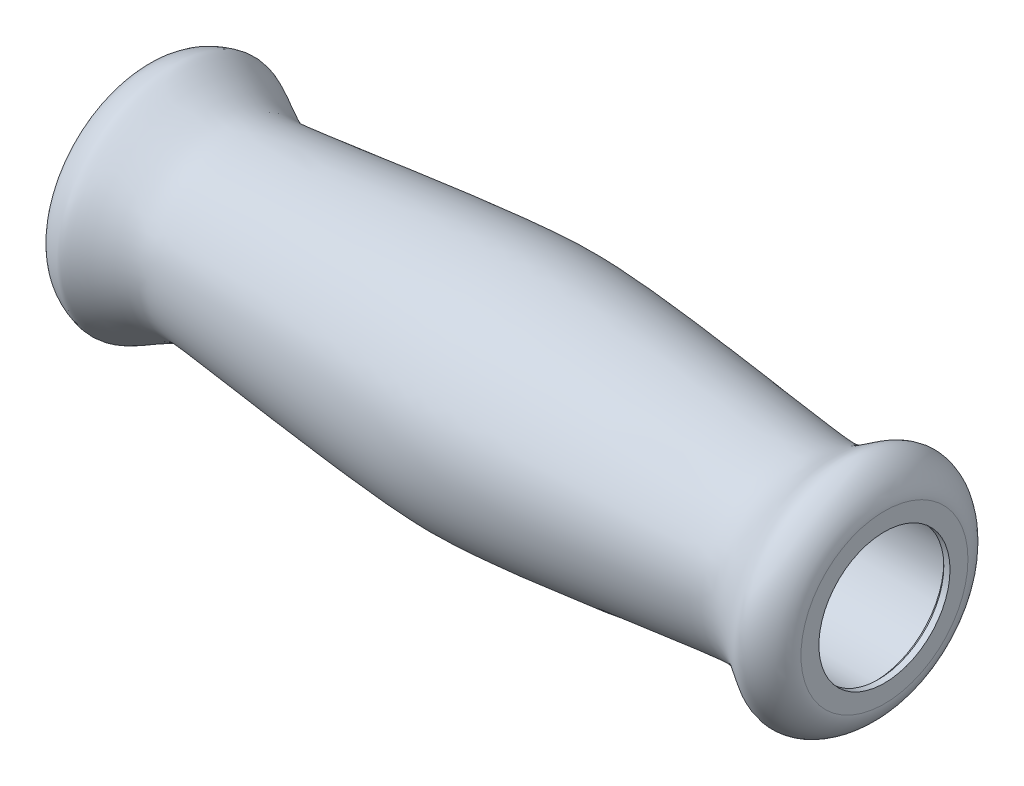
from build123d import *

# Parameters (mm, degrees)
SKETCH1_R           = 13.5
SKETCH1_R_2         = 11.2
BOSS_EXTRUDE1_DEPTH = 60
CIRPATTERN1_COUNT   = 8
LPATTERN1_COUNT     = 3
LPATTERN1_PITCH     = 20
FILLET1_R           = 3
SKETCH4_R           = 13.5
SKETCH4_R_2         = 11.2
BOSS_EXTRUDE2_DEPTH = 60
BOSS_EXTRUDE3_START = -1
SKETCH5_R           = 11.2
SKETCH5_R_2         = 10.6
BOSS_EXTRUDE3_DEPTH = 1
CHAMFER1_SIZE       = 0.6


# Some blends are built 0.0001 mm under size
with BuildPart() as part:
    # Sketch1 → Boss-Extrude1 (new body)
    with BuildSketch(Plane(origin=(0, 0, 0), x_dir=(0, 0, -1), z_dir=(1, 0, 0))):
        Circle(SKETCH1_R)
        Circle(SKETCH1_R_2, mode=Mode.SUBTRACT)
    extrude(amount=BOSS_EXTRUDE1_DEPTH)

    # Sketch2 → Cut-Revolve1 (revolve, cut)
    with BuildSketch(Plane.XY):
        with BuildLine():
            Line((8, 12.6), (8, 9.6))
            Line((8, 9.6), (11, 9.6))
            ThreePointArc((11, 9.6), (10.121320344, 11.721320344), (8, 12.6))
        make_face()
    cut_revolve1 = revolve(axis=Axis((8, 12.6, 0), (0, -1, 0)), mode=Mode.SUBTRACT)

    # CirPattern1: Cut-Revolve1 ×8 about axis
    cirpattern1_axis = Axis((0, 0, 0), (1, 0, 0))
    for i in range(1, CIRPATTERN1_COUNT):
        add(cut_revolve1.rotate(cirpattern1_axis, i * 360 / CIRPATTERN1_COUNT), mode=Mode.SUBTRACT)

    # LPattern1: Cut-Revolve1 ×3
    with Locations(*[(i * LPATTERN1_PITCH, 0, 0) for i in range(1, LPATTERN1_COUNT)]):
        add(cut_revolve1, mode=Mode.SUBTRACT)

    # LPattern1 copy 1 sketch → LPattern1 copy 1 (revolve, cut)
    with BuildSketch(Plane(origin=(20, 0, 0), x_dir=(1, 0, 0), z_dir=(0, -0.7071067811865475, 0.7071067811865476))):
        with BuildLine():
            Line((8, 12.6), (8, 9.6))
            Line((8, 9.6), (11, 9.6))
            ThreePointArc((11, 9.6), (10.121320344, 11.721320344), (8, 12.6))
        make_face()
    revolve(axis=Axis((28, 8.909545443, 8.909545443), (0, -0.7071067811865476, -0.7071067811865475)), mode=Mode.SUBTRACT)

    # LPattern1 copy 2 sketch → LPattern1 copy 2 (revolve, cut)
    with BuildSketch(Plane(origin=(40, 0, 0), x_dir=(1, 0, 0), z_dir=(0, -0.7071067811865475, 0.7071067811865476))):
        with BuildLine():
            Line((8, 12.6), (8, 9.6))
            Line((8, 9.6), (11, 9.6))
            ThreePointArc((11, 9.6), (10.121320344, 11.721320344), (8, 12.6))
        make_face()
    revolve(axis=Axis((48, 8.909545443, 8.909545443), (0, -0.7071067811865476, -0.7071067811865475)), mode=Mode.SUBTRACT)

    # LPattern1 copy 3 sketch → LPattern1 copy 3 (revolve, cut)
    with BuildSketch(Plane(origin=(20, 0, 0), x_dir=(1, 0, 0), z_dir=(0, -1, 0))):
        with BuildLine():
            Line((8, 12.6), (8, 9.6))
            Line((8, 9.6), (11, 9.6))
            ThreePointArc((11, 9.6), (10.121320344, 11.721320344), (8, 12.6))
        make_face()
    revolve(axis=Axis((28, 0, 12.6), (0, 0, -1)), mode=Mode.SUBTRACT)

    # LPattern1 copy 4 sketch → LPattern1 copy 4 (revolve, cut)
    with BuildSketch(Plane(origin=(40, 0, 0), x_dir=(1, 0, 0), z_dir=(0, -1, 0))):
        with BuildLine():
            Line((8, 12.6), (8, 9.6))
            Line((8, 9.6), (11, 9.6))
            ThreePointArc((11, 9.6), (10.121320344, 11.721320344), (8, 12.6))
        make_face()
    revolve(axis=Axis((48, 0, 12.6), (0, 0, -1)), mode=Mode.SUBTRACT)

    # LPattern1 copy 5 sketch → LPattern1 copy 5 (revolve, cut)
    with BuildSketch(Plane(origin=(20, 0, 0), x_dir=(1, 0, 0), z_dir=(0, -0.7071067811865476, -0.7071067811865475))):
        with BuildLine():
            Line((8, 12.6), (8, 9.6))
            Line((8, 9.6), (11, 9.6))
            ThreePointArc((11, 9.6), (10.121320344, 11.721320344), (8, 12.6))
        make_face()
    revolve(axis=Axis((28, -8.909545443, 8.909545443), (0, 0.7071067811865475, -0.7071067811865476)), mode=Mode.SUBTRACT)

    # LPattern1 copy 6 sketch → LPattern1 copy 6 (revolve, cut)
    with BuildSketch(Plane(origin=(40, 0, 0), x_dir=(1, 0, 0), z_dir=(0, -0.7071067811865476, -0.7071067811865475))):
        with BuildLine():
            Line((8, 12.6), (8, 9.6))
            Line((8, 9.6), (11, 9.6))
            ThreePointArc((11, 9.6), (10.121320344, 11.721320344), (8, 12.6))
        make_face()
    revolve(axis=Axis((48, -8.909545443, 8.909545443), (0, 0.7071067811865475, -0.7071067811865476)), mode=Mode.SUBTRACT)

    # LPattern1 copy 7 sketch → LPattern1 copy 7 (revolve, cut)
    with BuildSketch(Plane(origin=(20, 0, 0), x_dir=(1, 0, 0), z_dir=(0, 0, -1))):
        with BuildLine():
            Line((8, 12.6), (8, 9.6))
            Line((8, 9.6), (11, 9.6))
            ThreePointArc((11, 9.6), (10.121320344, 11.721320344), (8, 12.6))
        make_face()
    revolve(axis=Axis((28, -12.6, 0), (0, 1, 0)), mode=Mode.SUBTRACT)

    # LPattern1 copy 8 sketch → LPattern1 copy 8 (revolve, cut)
    with BuildSketch(Plane(origin=(40, 0, 0), x_dir=(1, 0, 0), z_dir=(0, 0, -1))):
        with BuildLine():
            Line((8, 12.6), (8, 9.6))
            Line((8, 9.6), (11, 9.6))
            ThreePointArc((11, 9.6), (10.121320344, 11.721320344), (8, 12.6))
        make_face()
    revolve(axis=Axis((48, -12.6, 0), (0, 1, 0)), mode=Mode.SUBTRACT)

    # LPattern1 copy 9 sketch → LPattern1 copy 9 (revolve, cut)
    with BuildSketch(Plane(origin=(20, 0, 0), x_dir=(1, 0, 0), z_dir=(0, 0.7071067811865475, -0.7071067811865477))):
        with BuildLine():
            Line((8, 12.6), (8, 9.6))
            Line((8, 9.6), (11, 9.6))
            ThreePointArc((11, 9.6), (10.121320344, 11.721320344), (8, 12.6))
        make_face()
    revolve(axis=Axis((28, -8.909545443, -8.909545443), (0, 0.7071067811865477, 0.7071067811865475)), mode=Mode.SUBTRACT)

    # LPattern1 copy 10 sketch → LPattern1 copy 10 (revolve, cut)
    with BuildSketch(Plane(origin=(40, 0, 0), x_dir=(1, 0, 0), z_dir=(0, 0.7071067811865475, -0.7071067811865477))):
        with BuildLine():
            Line((8, 12.6), (8, 9.6))
            Line((8, 9.6), (11, 9.6))
            ThreePointArc((11, 9.6), (10.121320344, 11.721320344), (8, 12.6))
        make_face()
    revolve(axis=Axis((48, -8.909545443, -8.909545443), (0, 0.7071067811865477, 0.7071067811865475)), mode=Mode.SUBTRACT)

    # LPattern1 copy 11 sketch → LPattern1 copy 11 (revolve, cut)
    with BuildSketch(Plane(origin=(20, 0, 0), x_dir=(1, 0, 0), z_dir=(0, 1, 0))):
        with BuildLine():
            Line((8, 12.6), (8, 9.6))
            Line((8, 9.6), (11, 9.6))
            ThreePointArc((11, 9.6), (10.121320344, 11.721320344), (8, 12.6))
        make_face()
    revolve(axis=Axis((28, 0, -12.6), (0, 0, 1)), mode=Mode.SUBTRACT)

    # LPattern1 copy 12 sketch → LPattern1 copy 12 (revolve, cut)
    with BuildSketch(Plane(origin=(40, 0, 0), x_dir=(1, 0, 0), z_dir=(0, 1, 0))):
        with BuildLine():
            Line((8, 12.6), (8, 9.6))
            Line((8, 9.6), (11, 9.6))
            ThreePointArc((11, 9.6), (10.121320344, 11.721320344), (8, 12.6))
        make_face()
    revolve(axis=Axis((48, 0, -12.6), (0, 0, 1)), mode=Mode.SUBTRACT)

    # LPattern1 copy 13 sketch → LPattern1 copy 13 (revolve, cut)
    with BuildSketch(Plane(origin=(20, 0, 0), x_dir=(1, 0, 0), z_dir=(0, 0.7071067811865477, 0.7071067811865474))):
        with BuildLine():
            Line((8, 12.6), (8, 9.6))
            Line((8, 9.6), (11, 9.6))
            ThreePointArc((11, 9.6), (10.121320344, 11.721320344), (8, 12.6))
        make_face()
    revolve(axis=Axis((28, 8.909545443, -8.909545443), (0, -0.7071067811865474, 0.7071067811865477)), mode=Mode.SUBTRACT)

    # LPattern1 copy 14 sketch → LPattern1 copy 14 (revolve, cut)
    with BuildSketch(Plane(origin=(40, 0, 0), x_dir=(1, 0, 0), z_dir=(0, 0.7071067811865477, 0.7071067811865474))):
        with BuildLine():
            Line((8, 12.6), (8, 9.6))
            Line((8, 9.6), (11, 9.6))
            ThreePointArc((11, 9.6), (10.121320344, 11.721320344), (8, 12.6))
        make_face()
    revolve(axis=Axis((48, 8.909545443, -8.909545443), (0, -0.7071067811865474, 0.7071067811865477)), mode=Mode.SUBTRACT)

    # Fillet1
    # the kernel refuses this fillet: 3 mm, written as the material it takes off along each edge
    with BuildSketch(Plane(origin=(0, 0, 0), x_dir=(0, 0, -1), z_dir=(0, -1, 0))) as fillet1_piece_1:
        with BuildLine():
            CenterArc((14.2, 2.917190429), FILLET1_R, 180, 76.506601178)
            Line((11.2, 2.917190429), (11.14, 2.917190429))
            Line((11.14, 2.917190429), (11.14, 0))
            Line((11.14, 0), (11.2, -0.06))
            ThreePointArc((11.2, -0.06), (12.35, -0.06), (13.486, -0.058343809))
            Line((13.486, -0.058343809), (13.5, 0))
        make_face()
    revolve(axis=Axis((0, 0, 0), (1, 0, 0)), mode=Mode.SUBTRACT)

    # Sketch3 → Revolve1 (revolve)
    with BuildSketch(Plane.XY, mode=Mode.PRIVATE) as revolve1_sk:
        with BuildLine():
            Line((0, 13.5), (120, 13.5))
            add(Edge.make_bspline(
                [(0, 13.5), (0, 17.1), (3.47848081, 18.244044123), (6.006761091, 18.733042825), (12.178491138, 14.472939521), (17.541360777, 14.457869162), (51.182719302, 18.692726809), (72.201875672, 18.333770949), (98.022233616, 14.861252756), (109.192763872, 14.19809109), (113.086612847, 18.63356108), (117.428024722, 18.405745032), (120, 15.3), (120, 13.5)],
                knots=[0, 0, 0, 0, 0.179684123, 0.215735279, 0.344425309, 0.376367627, 0.503216137, 0.539330853, 0.701400067, 0.734846354, 0.840347435, 0.868181563, 1, 1, 1, 1], degree=3))
        make_face()
    revolve(revolve1_sk.sketch.rotate(Axis((0, 0, 0), (1, 0, 0)), 90), axis=Axis((0, 0, 0), (1, 0, 0)))

    # Sketch4 → Boss-Extrude2 (add, through all)
    with BuildSketch(Plane(origin=(60, 0, 0), x_dir=(0, 0, -1), z_dir=(1, 0, 0))):
        Circle(SKETCH4_R)
        with Locations(Location((0, 0, 0), (0, 0, 180))):
            Circle(SKETCH4_R_2, mode=Mode.SUBTRACT)
    extrude(amount=BOSS_EXTRUDE2_DEPTH)

    # Sketch5 → Boss-Extrude3 (add)
    with BuildSketch(Plane(origin=(120, 0, 0), x_dir=(0, 0, -1), z_dir=(1, 0, 0)).offset(BOSS_EXTRUDE3_START)):
        with Locations(Location((0, 0, 0), (0, 0, 180))):
            Circle(SKETCH5_R)
        Circle(SKETCH5_R_2, mode=Mode.SUBTRACT)
    extrude(amount=BOSS_EXTRUDE3_DEPTH)

    # Chamfer1
    chamfer1_edges = [part.edges().sort_by_distance(p)[0] for p in [
        (119, 0, -11.2),
    ]]
    chamfer(chamfer1_edges, length=CHAMFER1_SIZE - 0.0001)  # a hair under: the kernel refuses the full size


solid = part.part
